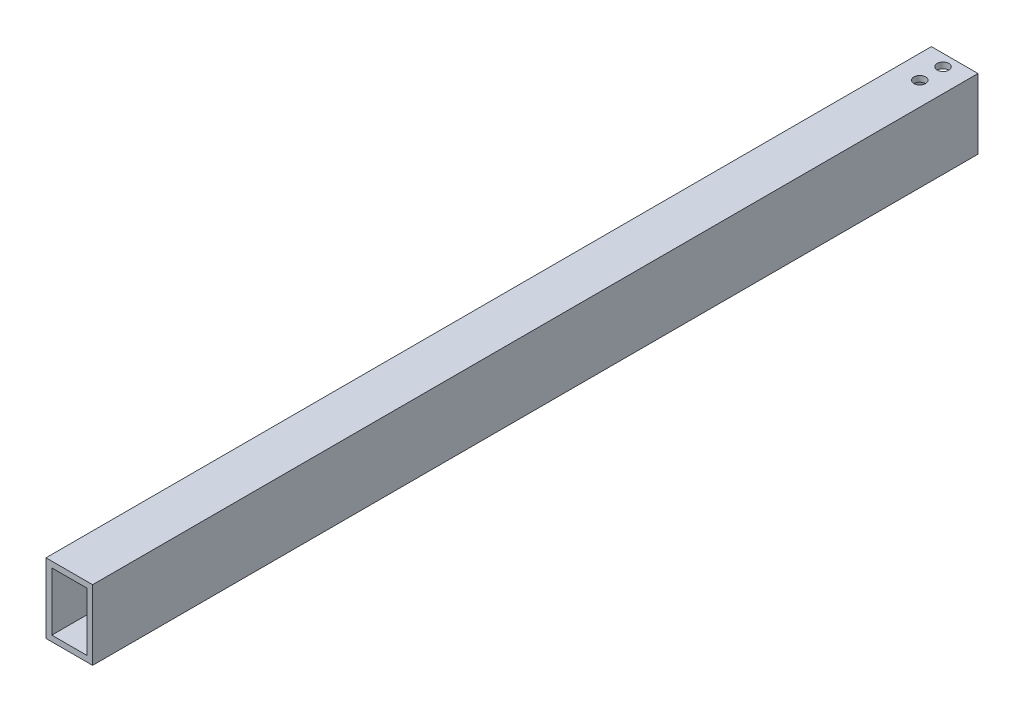
from build123d import *

# Parameters (mm, degrees)
SKETCH1_W           = 25.4
SKETCH1_H           = 38.1
SKETCH1_W_2         = 19.05
SKETCH1_H_2         = 31.75
BOSS_EXTRUDE1_DEPTH = 482.6
SKETCH2_R           = 3.175
CUT_EXTRUDE1_DEPTH  = 485.268169509


with BuildPart() as part:
    # Sketch1 → Boss-Extrude1 (new body)
    with BuildSketch(Plane.XY):
        Rectangle(SKETCH1_W, SKETCH1_H)
        Rectangle(SKETCH1_W_2, SKETCH1_H_2, mode=Mode.SUBTRACT)
    extrude(amount=BOSS_EXTRUDE1_DEPTH)

    # Sketch2 → Cut-Extrude1 (cut, through all)
    with BuildSketch(Plane(origin=(0, 19.05, 0), x_dir=(1, 0, 0), z_dir=(0, 1, 0))):
        with Locations((0, -19.05)):
            Circle(SKETCH2_R)
        with Locations((0, -6.35)):
            Circle(SKETCH2_R)
    extrude(amount=-CUT_EXTRUDE1_DEPTH, mode=Mode.SUBTRACT)


solid = part.part
